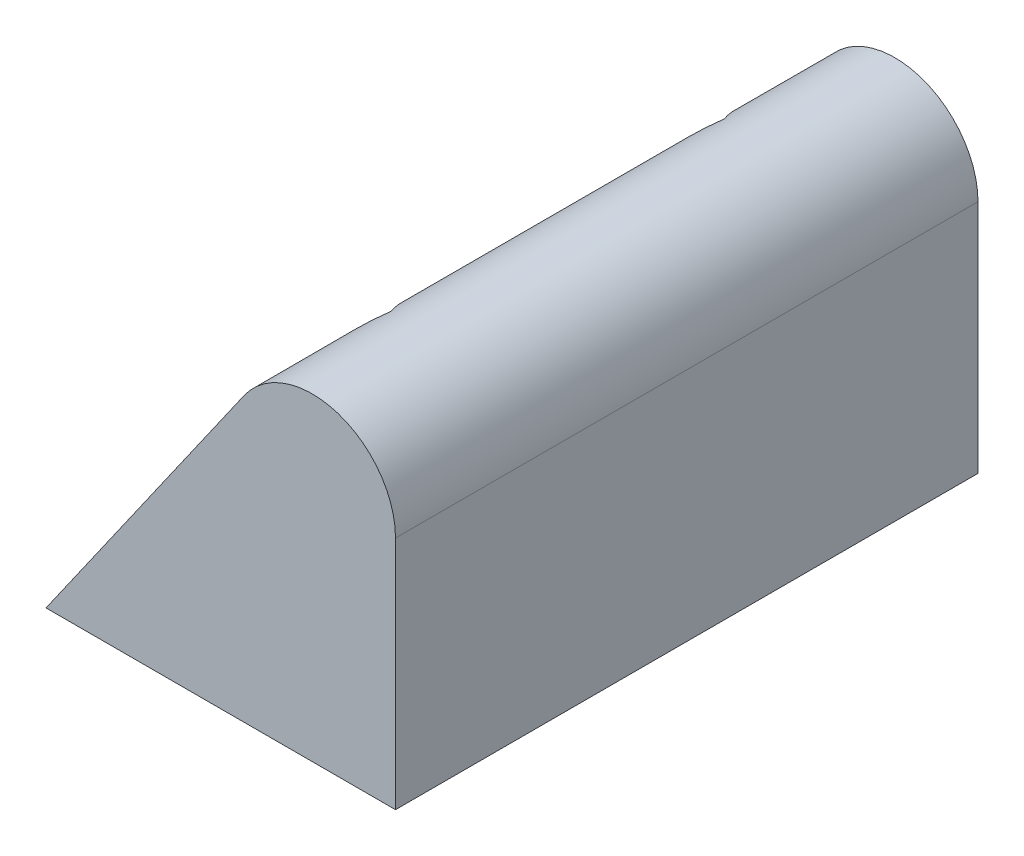
from build123d import *

# Parameters (mm, degrees)
BOSS_EXTRUDE1_DEPTH = 35
SKETCH2_R           = 1.6
CUT_EXTRUDE1_DEPTH  = 51.655700568
CUT_EXTRUDE2_START  = -3
CUT_EXTRUDE2_DEPTH  = 48.655700568
FILLET1_R           = 5


with BuildPart() as part:
    # Sketch1 → Boss-Extrude1 (new body)
    with BuildSketch(Plane.XY):
        Polygon((0, 0), (21, 30), (21, 0), align=None)
    extrude(amount=BOSS_EXTRUDE1_DEPTH)

    # Sketch2 → Cut-Extrude1 (cut, through all)
    with BuildSketch(Plane.XZ):
        with Locations((10, 27.5)):
            Circle(SKETCH2_R)
        with Locations(Location((10, 7.5, 0), (0, 0, 180))):
            Circle(SKETCH2_R)
    extrude(amount=-CUT_EXTRUDE1_DEPTH, mode=Mode.SUBTRACT)

    # Sketch3 → Cut-Extrude2 (cut, through all)
    with BuildSketch(Plane.XZ.offset(CUT_EXTRUDE2_START)):
        Polygon((13.233161507, 27.5), (11.616580754, 30.3), (8.383419246, 30.3), (6.766838493, 27.5), (8.383419246, 24.7), (11.616580754, 24.7), align=None)
        Polygon((13.233161507, 7.5), (11.616580754, 10.3), (8.383419246, 10.3), (6.766838493, 7.5), (8.383419246, 4.7), (11.616580754, 4.7), align=None)
    extrude(amount=-CUT_EXTRUDE2_DEPTH, mode=Mode.SUBTRACT)

    # Fillet1
    # the kernel refuses this fillet: 5 mm, written as the material it takes off along each edge
    with BuildSketch(Plane(origin=(21, 30, -39.6545636), x_dir=(-0.5734623443633282, -0.8192319205190405, 0), z_dir=(0, 0, 1))) as fillet1_piece_1:
        with BuildLine():
            CenterArc((FILLET1_R * 3.17236508796, FILLET1_R), FILLET1_R, 124.992020199, 145.007979801)
            Line((FILLET1_R * 2.5989027436, FILLET1_R * 1.81923192052), (0, 0))
            Line((0, 0), (FILLET1_R * 3.17236508796, 0))
        make_face()
    extrude(amount=114.309127199, mode=Mode.SUBTRACT)


solid = part.part
